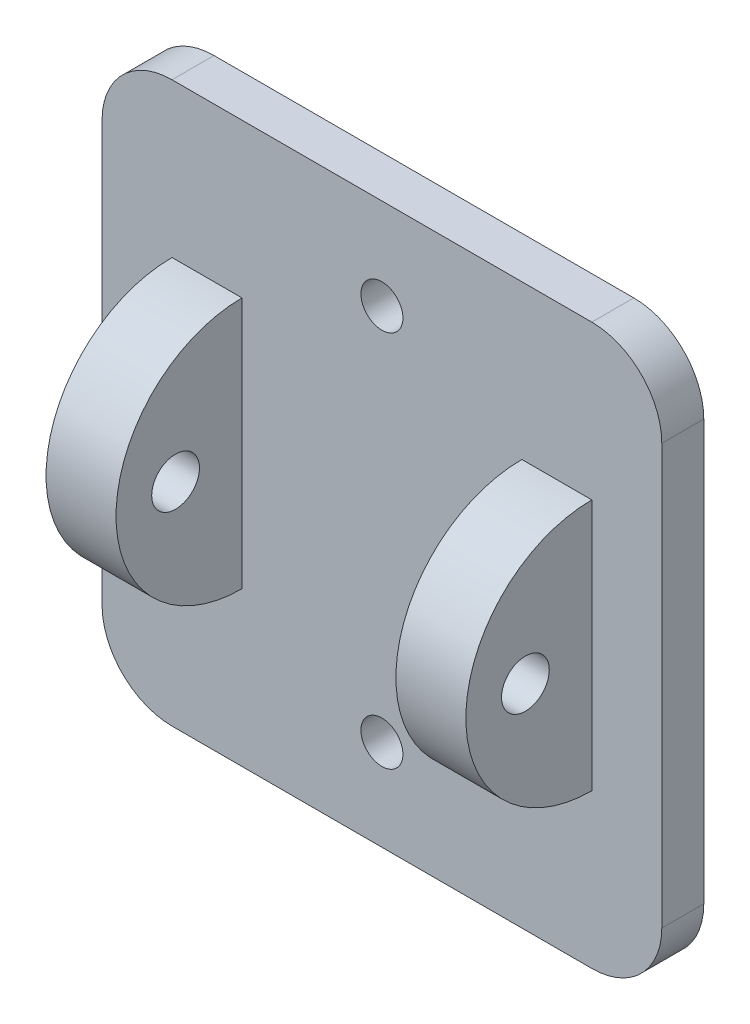
from build123d import *

# Parameters (mm, degrees)
CROQUIS1_R              = 1.5
SALIENTE_EXTRUIR1_DEPTH = 3
SALIENTE_EXTRUIR2_START = 3
CROQUIS2_W              = 5
CROQUIS2_H              = 18
SALIENTE_EXTRUIR2_DEPTH = 9
REDONDEO6_R             = 9
REDONDEO7_R             = 9
CORTAR_EXTRUIR1_REACH   = 47.338
CROQUIS3_R              = 1.705559653


with BuildPart() as part:
    # Croquis1 → Saliente-Extruir1 (new body)
    with BuildSketch(Plane.XY):
        with BuildLine():
            Line((-7.68763367, 13.798076923), (22.31236633, 13.798076923))
            ThreePointArc((22.31236633, 13.798076923), (25.847900236, 12.333610829), (27.31236633, 8.798076923))
            Line((27.31236633, 8.798076923), (27.31236633, -21.201923077))
            ThreePointArc((27.31236633, -21.201923077), (25.847900236, -24.737456983), (22.31236633, -26.201923077))
            Line((22.31236633, -26.201923077), (-7.68763367, -26.201923077))
            ThreePointArc((-7.68763367, -26.201923077), (-11.223167576, -24.737456983), (-12.68763367, -21.201923077))
            Line((-12.68763367, -21.201923077), (-12.68763367, 8.798076923))
            ThreePointArc((-12.68763367, 8.798076923), (-11.223167576, 12.333610829), (-7.68763367, 13.798076923))
        make_face()
        with Locations((7.31236633, 7.298076923)):
            Circle(CROQUIS1_R, mode=Mode.SUBTRACT)
        with Locations((7.31236633, -19.701923077)):
            Circle(CROQUIS1_R, mode=Mode.SUBTRACT)
    extrude(amount=SALIENTE_EXTRUIR1_DEPTH)

    # Croquis2 → Saliente-Extruir2 (add)
    with BuildSketch(Plane.XY.offset(SALIENTE_EXTRUIR2_START)):
        with Locations((-5.18763367, -6.201923077)):
            Rectangle(CROQUIS2_W, CROQUIS2_H)
        with Locations((19.81236633, -6.201923077)):
            Rectangle(CROQUIS2_W, CROQUIS2_H)
    extrude(amount=SALIENTE_EXTRUIR2_DEPTH)

    # Redondeo6
    redondeo6_edges = [part.edges().sort_by_distance(p)[0] for p in [
        (-5.18763367, 2.798076923, 12),
        (-5.18763367, -15.201923077, 12),
    ]]
    fillet(redondeo6_edges, radius=REDONDEO6_R - 0.0001)  # a hair under: the kernel refuses the full size

    # Redondeo7
    redondeo7_edges = [part.edges().sort_by_distance(p)[0] for p in [
        (19.81236633, -15.201923077, 12),
        (19.81236633, 2.798076923, 12),
    ]]
    fillet(redondeo7_edges, radius=REDONDEO7_R - 0.0001)  # a hair under: the kernel refuses the full size

    # Cortar-Extruir1: up to this face of the body (flat: up to its plane)
    cortar_extruir1_end = Plane(part.part.faces().sort_by_distance((22.31236633, -6.201923077, 6.819731779))[0])
    # Croquis3 → Cortar-Extruir1 (cut, up to the picked face)
    with BuildSketch(Plane.ZY.offset(7.68763367), mode=Mode.PRIVATE) as cortar_extruir1_sk1:
        with Locations((7.74625312, -6.201923077)):
            Circle(CROQUIS3_R)
    cortar_extruir1_tool1 = split(extrude(cortar_extruir1_sk1.sketch, amount=-CORTAR_EXTRUIR1_REACH, mode=Mode.PRIVATE), bisect_by=cortar_extruir1_end, keep=Keep.BOTH, mode=Mode.PRIVATE)
    add(cortar_extruir1_tool1.solids().sort_by(Axis((-7.687634, -6.201923, 7.746253), (1, 0, 0)))[0], mode=Mode.SUBTRACT)


solid = part.part
